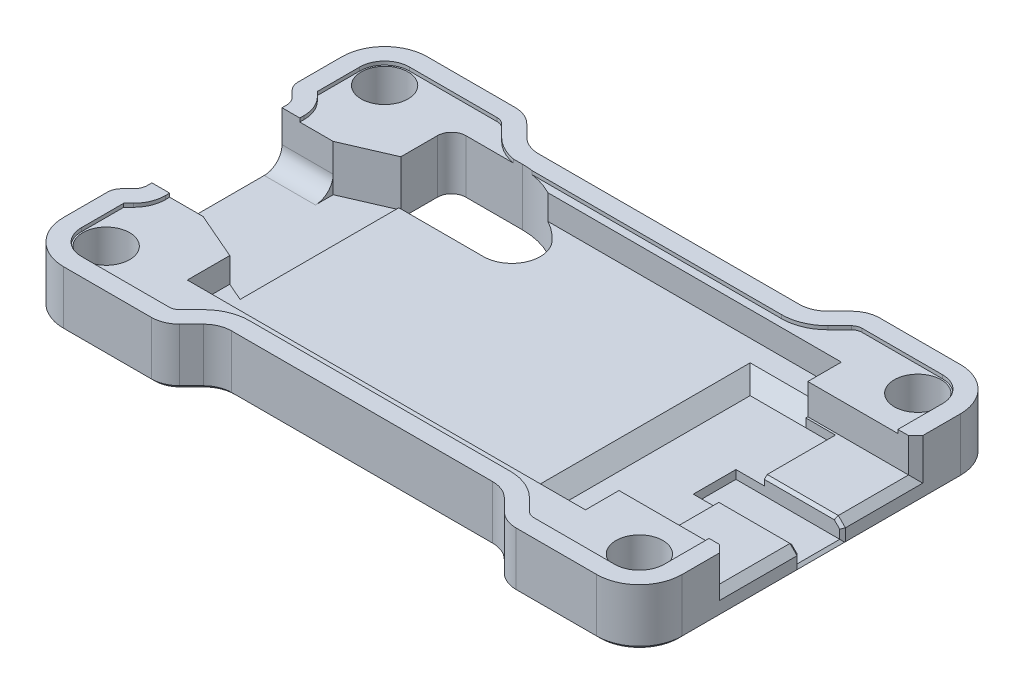
from build123d import *

# Parameters (mm, degrees)
BOSS_EXTRUDE1_DEPTH     = 4
FILLET1_R               = 3
FILLET2_R               = 1
FILLET3_R               = 2
SKETCH2_W               = 8
SKETCH2_H               = 9.15
CUT_EXTRUDE1_DEPTH      = 3.5
FILLET4_R               = 1.25
SKETCH3_W               = 9.941274404
SKETCH3_H               = 15.481085324
BOSS_EXTRUDE2_DEPTH     = 1.6
CHAMFER1_SIZE           = 0.5
SKETCH4_W               = 28
SKETCH4_H               = 18
CUT_EXTRUDE2_DEPTH      = 2
SKETCH5_R               = 1.65
CUT_EXTRUDE3_DEPTH      = 45.562698527
SKETCH6_W               = 3
SKETCH6_H               = 3.2
CUT_EXTRUDE4_DEPTH      = 7.5
CHAMFER2_SIZE           = 0.2
CHAMFER3_SIZE           = 0.25
CUT_EXTRUDE5_DEPTH      = 45.42785275
CUT_EXTRUDE5_DEPTH_BACK = 45.42785275
SKETCH7_W               = 10
SKETCH7_H               = 5
FILLET5_R               = 5
FILLET6_R               = 2
FILLET7_R               = 1
SKETCH9_W               = 4
SKETCH9_H               = 13
CUT_EXTRUDE8_DEPTH      = 1
CHAMFER5_SIZE           = 1
CUT_EXTRUDE9_REACH      = 46.563
CUT_EXTRUDE10_DEPTH     = 0.25


# Some blends are built 0.0001 mm under size
with BuildPart() as part:
    # Sketch1 → Boss-Extrude1 (new body)
    with BuildSketch(Plane(origin=(0, 0, 0), x_dir=(1, 0, 0), z_dir=(0, 1, 0))):
        Polygon((0, -5.29), (0, 5.29), (-1, 6.29), (-1, 12.79), (9, 12.79), (11, 10.79), (31, 10.79), (33, 12.79), (42.5, 12.79), (42.5, 6.64), (33.85, 6.64), (33.85, -6.64), (42.5, -6.64), (42.5, -12.79), (33, -12.79), (31, -10.79), (11, -10.79), (9, -12.79), (-1, -12.79), (-1, -6.29), align=None)
    extrude(amount=BOSS_EXTRUDE1_DEPTH)

    # Fillet1
    fillet1_edges = [part.edges().sort_by_distance(p)[0] for p in [
        (-1, 2, -12.79),
        (42.5, 2, -12.79),
        (42.5, 2, 12.79),
        (-1, 2, 12.79),
    ]]
    fillet(fillet1_edges, radius=FILLET1_R)

    # Fillet2
    fillet2_edges = [part.edges().sort_by_distance(p)[0] for p in [
        (-1, 2, -6.29),
        (33.85, 2, -6.64),
        (33.85, 2, 6.64),
        (-1, 2, 6.29),
        (0, 2, 5.29),
        (0, 2, -5.29),
    ]]
    fillet(fillet2_edges, radius=FILLET2_R)

    # Fillet3
    fillet3_edges = [part.edges().sort_by_distance(p)[0] for p in [
        (9, 2, -12.79),
        (11, 2, -10.79),
        (31, 2, -10.79),
        (33, 2, -12.79),
        (33, 2, 12.79),
        (31, 2, 10.79),
        (11, 2, 10.79),
        (9, 2, 12.79),
    ]]
    fillet(fillet3_edges, radius=FILLET3_R)

    # Sketch2 → Cut-Extrude1 (cut)
    with BuildSketch(Plane(origin=(0, 4, 0), x_dir=(1, 0, 0), z_dir=(0, 1, 0))):
        with Locations((3.75, 0)):
            Rectangle(SKETCH2_W, SKETCH2_H)
    extrude(amount=-CUT_EXTRUDE1_DEPTH, mode=Mode.SUBTRACT)

    # Fillet4
    fillet4_edges = [part.edges().sort_by_distance(p)[0] for p in [
        (3.875, 0.5, 4.575),
        (3.875, 0.5, -4.575),
    ]]
    fillet(fillet4_edges, radius=FILLET4_R)

    # Sketch3 → Boss-Extrude2 (add)
    with BuildSketch(Plane.XZ):
        with Locations((37.529362798, 0.175921424)):
            Rectangle(SKETCH3_W, SKETCH3_H)
    extrude(amount=-BOSS_EXTRUDE2_DEPTH)

    # Chamfer1
    chamfer1_edges = [part.edges().sort_by_distance(p)[0] for p in [
        (42.5, 1.6, 0),
        (42.5, 2.8, -6.64),
        (42.5, 2.8, 6.64),
    ]]
    chamfer(chamfer1_edges, length=CHAMFER1_SIZE)

    # Sketch4 → Cut-Extrude2 (cut)
    with BuildSketch(Plane(origin=(0, 4, 0), x_dir=(1, 0, 0), z_dir=(0, 1, 0))):
        with Locations((20.914926335, 0)):
            Rectangle(SKETCH4_W, SKETCH4_H)
    extrude(amount=-CUT_EXTRUDE2_DEPTH, mode=Mode.SUBTRACT)

    # Sketch5 → Cut-Extrude3 (cut, through all)
    with BuildSketch(Plane(origin=(0, 4, 0), x_dir=(1, 0, 0), z_dir=(0, 1, 0))):
        with Locations(Location((2, 9.79, 0), (0, 0, 270))):
            Circle(SKETCH5_R)
        with Locations(Location((2, -9.79, 0), (0, 0, 270))):
            Circle(SKETCH5_R)
        with Locations(Location((39.5, 9.79, 0), (0, 0, 270))):
            Circle(SKETCH5_R)
        with Locations(Location((39.5, -9.79, 0), (0, 0, 270))):
            Circle(SKETCH5_R)
    extrude(amount=-CUT_EXTRUDE3_DEPTH, mode=Mode.SUBTRACT)

    # Sketch6 → Cut-Extrude4 (cut)
    with BuildSketch(Plane(origin=(42.5, 0, 0), x_dir=(0, 0, -1), z_dir=(1, 0, 0))):
        with Locations((0, 2)):
            Rectangle(SKETCH6_W, SKETCH6_H)
    extrude(amount=-CUT_EXTRUDE4_DEPTH, mode=Mode.SUBTRACT)

    # Chamfer2
    chamfer2_edges = [part.edges().sort_by_distance(p)[0] for p in [
        (42.25, 1.35, 1.5),
        (42.25, 1.35, -1.5),
        (38.5, 1.6, -1.5),
        (38.5, 1.6, 1.5),
        (42.5, 0.75, -1.5),
        (42.5, 0.75, 1.5),
        (42.5, 0.4, 0),
    ]]
    chamfer(chamfer2_edges, length=CHAMFER2_SIZE)

    # Chamfer3
    # the kernel refuses this chamfer: 0.25 mm, written as the material it takes off along each edge
    with BuildSketch(Plane(origin=(-0.292893219, 0, -5.582893219), x_dir=(-0.019442520806013684, 0.9996219169112968, 0.01944252080601369), z_dir=(-0.7071067811865477, 0, -0.7071067811865475)), Plane(origin=(-0.707106781, 0, 5.997106781), x_dir=(-0.019442520806014003, 0.9996219169112968, -0.01944252080601401), z_dir=(0.7071067811865477, 0, -0.7071067811865475))) as chamfer3_piece_1:
        Polygon((CHAMFER3_SIZE * 0.999621916911, CHAMFER3_SIZE * 0.0274958766106), (-CHAMFER3_SIZE * 0.0274958766106, CHAMFER3_SIZE * 0.999621916911), (0, 0), align=None)
    extrude(amount=0.585786438, mode=Mode.SUBTRACT)
    with BuildSketch(Plane(origin=(-1, 0, -4.875786438), x_dir=(0.7071067811865471, 0, -0.7071067811865479), z_dir=(-0.7071067811865479, 0, -0.7071067811865471))) as chamfer3_piece_2:
        Polygon((1, -CHAMFER3_SIZE), (1 + CHAMFER3_SIZE, 0), (1, 0), align=None)
    revolve(axis=Axis((-1, 0, -4.875786438), (0, -1, 0)), revolution_arc=45, mode=Mode.SUBTRACT)
    with BuildSketch(Plane(origin=(0, 0, -6.704213562), x_dir=(-1, 0, 0), z_dir=(0, 0, -1))) as chamfer3_piece_3:
        Polygon((1, CHAMFER3_SIZE), (1 - CHAMFER3_SIZE, 0), (1, 0), align=None)
    revolve(axis=Axis((0, 0, -6.704213562), (0, 1, 0)), revolution_arc=45, mode=Mode.SUBTRACT)
    with BuildSketch(Plane(origin=(0, 0, 4.875786438), x_dir=(-0.027495876610586372, 0.9996219169112968, 0), z_dir=(0, 0, -1))) as chamfer3_piece_4:
        Polygon((CHAMFER3_SIZE * 0.999621916911, CHAMFER3_SIZE * 0.0274958766106), (-CHAMFER3_SIZE * 0.0274958766106, CHAMFER3_SIZE * 0.999621916911), (0, 0), align=None)
    extrude(amount=9.751572875, mode=Mode.SUBTRACT)
    with BuildSketch(Plane(origin=(-1, 0, -6.704213562), x_dir=(-0.027495876610586494, 0.9996219169112968, 0), z_dir=(0, 0, -1)), Plane(origin=(-1, 0, 9.79), x_dir=(-0.027495876610586494, 0.9996219169112968, 0), z_dir=(0, 0, -1))) as chamfer3_piece_5:
        Polygon((CHAMFER3_SIZE * 0.999621916911, CHAMFER3_SIZE * 0.0274958766106), (-CHAMFER3_SIZE * 0.0274958766106, CHAMFER3_SIZE * 0.999621916911), (0, 0), align=None)
    extrude(amount=3.085786438, mode=Mode.SUBTRACT)
    with BuildSketch(Plane(origin=(-1, 0, 4.875786438), x_dir=(1, 0, 0), z_dir=(0, 0, -1))) as chamfer3_piece_6:
        Polygon((1, -CHAMFER3_SIZE), (1 + CHAMFER3_SIZE, 0), (1, 0), align=None)
    revolve(axis=Axis((-1, 0, 4.875786438), (0, -1, 0)), revolution_arc=45, mode=Mode.SUBTRACT)
    with BuildSketch(Plane(origin=(2, 0, -9.79), x_dir=(-1, 0, 0), z_dir=(0, 0, 1))) as chamfer3_piece_7:
        Polygon((3, -CHAMFER3_SIZE), (3 - CHAMFER3_SIZE, 0), (3, 0), align=None)
    revolve(axis=Axis((2, 0, -9.79), (0, -1, 0)), revolution_arc=90, mode=Mode.SUBTRACT)
    with BuildSketch(Plane(origin=(2, 0, -12.79), x_dir=(0, 0.9996219169112968, -0.02749587661058908), z_dir=(1, 0, 0)), Plane(origin=(8.171572875, 0, 12.79), x_dir=(0, 0.9996219169112968, 0.02749587661058908), z_dir=(-1, 0, 0))) as chamfer3_piece_8:
        Polygon((CHAMFER3_SIZE * 0.999621916911, CHAMFER3_SIZE * 0.0274958766106), (-CHAMFER3_SIZE * 0.0274958766106, CHAMFER3_SIZE * 0.999621916911), (0, 0), align=None)
    extrude(amount=6.171572875, mode=Mode.SUBTRACT)
    with BuildSketch(Plane(origin=(0, 0, 6.704213562), x_dir=(-0.7071067811865471, 0, -0.7071067811865479), z_dir=(0.7071067811865479, 0, -0.7071067811865471))) as chamfer3_piece_9:
        Polygon((1, CHAMFER3_SIZE), (1 - CHAMFER3_SIZE, 0), (1, 0), align=None)
    revolve(axis=Axis((0, 0, 6.704213562), (0, 1, 0)), revolution_arc=45, mode=Mode.SUBTRACT)
    with BuildSketch(Plane(origin=(8.171572875, 0, -10.79), x_dir=(0, 0, -1), z_dir=(-1, 0, 0))) as chamfer3_piece_10:
        Polygon((2, -CHAMFER3_SIZE), (2 - CHAMFER3_SIZE, 0), (2, 0), align=None)
    revolve(axis=Axis((8.171572875, 0, -10.79), (0, -1, 0)), revolution_arc=45, mode=Mode.SUBTRACT)
    with BuildSketch(Plane(origin=(9.585786438, 0, -12.204213562), x_dir=(0.01944252080601724, 0.9996219169112965, -0.01944252080601724), z_dir=(0.7071067811865476, 0, 0.7071067811865476)), Plane(origin=(10.414213562, 0, 11.375786438), x_dir=(0.01944252080601724, 0.9996219169112965, 0.01944252080601724), z_dir=(-0.7071067811865476, 0, 0.7071067811865476)), Plane(origin=(31.585786438, 0, -11.375786438), x_dir=(-0.01944252080601034, 0.999621916911297, -0.01944252080601034), z_dir=(0.7071067811865476, 0, -0.7071067811865476)), Plane(origin=(32.414213562, 0, 12.204213562), x_dir=(-0.019442520806020696, 0.9996219169112965, 0.019442520806020696), z_dir=(-0.7071067811865476, 0, -0.7071067811865476))) as chamfer3_piece_11:
        Polygon((CHAMFER3_SIZE * 0.999621916911, CHAMFER3_SIZE * 0.0274958766106), (-CHAMFER3_SIZE * 0.0274958766106, CHAMFER3_SIZE * 0.999621916911), (0, 0), align=None)
    extrude(amount=1.171572875, mode=Mode.SUBTRACT)
    with BuildSketch(Plane(origin=(2, 0, 9.79), x_dir=(0, 0, 1), z_dir=(1, 0, 0))) as chamfer3_piece_12:
        Polygon((3, -CHAMFER3_SIZE), (3 - CHAMFER3_SIZE, 0), (3, 0), align=None)
    revolve(axis=Axis((2, 0, 9.79), (0, -1, 0)), revolution_arc=90, mode=Mode.SUBTRACT)
    with BuildSketch(Plane(origin=(11.828427125, 0, -12.79), x_dir=(-0.707106781186548, 0, 0.7071067811865471), z_dir=(-0.7071067811865471, 0, -0.707106781186548))) as chamfer3_piece_13:
        Polygon((2, CHAMFER3_SIZE), (2 + CHAMFER3_SIZE, 0), (2, 0), align=None)
    revolve(axis=Axis((11.828427125, 0, -12.79), (0, 1, 0)), revolution_arc=45, mode=Mode.SUBTRACT)
    with BuildSketch(Plane(origin=(11.828427125, 0, -10.79), x_dir=(0, 0.9996219169112968, -0.02749587661058908), z_dir=(1, 0, 0)), Plane(origin=(30.171572875, 0, 10.79), x_dir=(0, 0.9996219169112968, 0.02749587661058908), z_dir=(-1, 0, 0))) as chamfer3_piece_14:
        Polygon((CHAMFER3_SIZE * 0.999621916911, CHAMFER3_SIZE * 0.0274958766106), (-CHAMFER3_SIZE * 0.0274958766106, CHAMFER3_SIZE * 0.999621916911), (0, 0), align=None)
    extrude(amount=18.343145751, mode=Mode.SUBTRACT)
    with BuildSketch(Plane(origin=(8.171572875, 0, 10.79), x_dir=(0, 0, 1), z_dir=(-1, 0, 0))) as chamfer3_piece_15:
        Polygon((2, CHAMFER3_SIZE), (2 - CHAMFER3_SIZE, 0), (2, 0), align=None)
    revolve(axis=Axis((8.171572875, 0, 10.79), (0, 1, 0)), revolution_arc=45, mode=Mode.SUBTRACT)
    with BuildSketch(Plane(origin=(30.171572875, 0, -12.79), x_dir=(0, 0, 1), z_dir=(-1, 0, 0))) as chamfer3_piece_16:
        Polygon((2, CHAMFER3_SIZE), (2 + CHAMFER3_SIZE, 0), (2, 0), align=None)
    revolve(axis=Axis((30.171572875, 0, -12.79), (0, 1, 0)), revolution_arc=45, mode=Mode.SUBTRACT)
    with BuildSketch(Plane(origin=(11.828427125, 0, 12.79), x_dir=(-0.7071067811865476, 0, -0.7071067811865476), z_dir=(-0.7071067811865476, 0, 0.7071067811865476))) as chamfer3_piece_17:
        Polygon((2, -CHAMFER3_SIZE), (2 + CHAMFER3_SIZE, 0), (2, 0), align=None)
    revolve(axis=Axis((11.828427125, 0, 12.79), (0, -1, 0)), revolution_arc=45, mode=Mode.SUBTRACT)
    with BuildSketch(Plane(origin=(33.828427125, 0, -10.79), x_dir=(-0.7071067811865462, 0, -0.7071067811865489), z_dir=(-0.7071067811865489, 0, 0.7071067811865462))) as chamfer3_piece_18:
        Polygon((2, -CHAMFER3_SIZE), (2 - CHAMFER3_SIZE, 0), (2, 0), align=None)
    revolve(axis=Axis((33.828427125, 0, -10.79), (0, -1, 0)), revolution_arc=45, mode=Mode.SUBTRACT)
    with BuildSketch(Plane(origin=(33.828427125, 0, -12.79), x_dir=(0, 0.9996219169112968, -0.02749587661058908), z_dir=(1, 0, 0)), Plane(origin=(39.5, 0, 12.79), x_dir=(0, 0.9996219169112968, 0.02749587661058908), z_dir=(-1, 0, 0))) as chamfer3_piece_19:
        Polygon((CHAMFER3_SIZE * 0.999621916911, CHAMFER3_SIZE * 0.0274958766106), (-CHAMFER3_SIZE * 0.0274958766106, CHAMFER3_SIZE * 0.999621916911), (0, 0), align=None)
    extrude(amount=5.671572875, mode=Mode.SUBTRACT)
    with BuildSketch(Plane(origin=(30.171572875, 0, 12.79), x_dir=(0, 0, -1), z_dir=(-1, 0, 0))) as chamfer3_piece_20:
        Polygon((2, -CHAMFER3_SIZE), (2 + CHAMFER3_SIZE, 0), (2, 0), align=None)
    revolve(axis=Axis((30.171572875, 0, 12.79), (0, -1, 0)), revolution_arc=45, mode=Mode.SUBTRACT)
    with BuildSketch(Plane(origin=(39.5, 0, -9.79), x_dir=(0, 0, -1), z_dir=(-1, 0, 0))) as chamfer3_piece_21:
        Polygon((3, -CHAMFER3_SIZE), (3 - CHAMFER3_SIZE, 0), (3, 0), align=None)
    revolve(axis=Axis((39.5, 0, -9.79), (0, -1, 0)), revolution_arc=90, mode=Mode.SUBTRACT)
    with BuildSketch(Plane(origin=(42.5, 0, -9.79), x_dir=(0.027495876610582174, 0.9996219169112968, 0), z_dir=(0, 0, 1))) as chamfer3_piece_22:
        Polygon((CHAMFER3_SIZE * 0.999621916911, CHAMFER3_SIZE * 0.0274958766106), (-CHAMFER3_SIZE * 0.0274958766106, CHAMFER3_SIZE * 0.999621916911), (0, 0), align=None)
    extrude(amount=19.58, mode=Mode.SUBTRACT)
    with BuildSketch(Plane(origin=(33.828427125, 0, 10.79), x_dir=(-0.7071067811865489, 0, 0.7071067811865462), z_dir=(-0.7071067811865462, 0, -0.7071067811865489))) as chamfer3_piece_23:
        Polygon((2, CHAMFER3_SIZE), (2 - CHAMFER3_SIZE, 0), (2, 0), align=None)
    revolve(axis=Axis((33.828427125, 0, 10.79), (0, 1, 0)), revolution_arc=45, mode=Mode.SUBTRACT)
    with BuildSketch(Plane(origin=(39.5, 0, 9.79), x_dir=(1, 0, 0), z_dir=(0, 0, -1))) as chamfer3_piece_24:
        Polygon((3 - CHAMFER3_SIZE, 0), (3, -CHAMFER3_SIZE), (3, 0), align=None)
    revolve(axis=Axis((39.5, 0, 9.79), (0, -1, 0)), revolution_arc=90, mode=Mode.SUBTRACT)

    # Sketch7 → Cut-Extrude5 (cut, two sides: drawn at the far end of the back side and taken through both)
    with BuildSketch(Plane(origin=(0, 2, 0), x_dir=(1, 0, 0), z_dir=(0, 1, 0)).offset(-CUT_EXTRUDE5_DEPTH_BACK)):
        with Locations((11.914926335, 7.09)):
            Rectangle(SKETCH7_W, SKETCH7_H)
    extrude(amount=CUT_EXTRUDE5_DEPTH + CUT_EXTRUDE5_DEPTH_BACK, mode=Mode.SUBTRACT)

    # Fillet5
    fillet5_edges = [part.edges().sort_by_distance(p)[0] for p in [
        (16.914926335, 2, -9.59),
    ]]
    fillet(fillet5_edges, radius=FILLET5_R - 0.0001)  # a hair under: the kernel refuses the full size

    # Fillet6
    fillet6_edges = [part.edges().sort_by_distance(p)[0] for p in [
        (16.914926335, 1, -4.59),
    ]]
    fillet(fillet6_edges, radius=FILLET6_R)

    # Fillet7
    fillet7_edges = [part.edges().sort_by_distance(p)[0] for p in [
        (6.914926335, 1, -4.59),
        (6.914926335, 2, -9.59),
    ]]
    fillet(fillet7_edges, radius=FILLET7_R)

    # Sketch9 → Cut-Extrude8 (cut)
    with BuildSketch(Plane(origin=(0, 2, 0), x_dir=(1, 0, 0), z_dir=(0, 1, 0))):
        with Locations((35, 0)):
            Rectangle(SKETCH9_W, SKETCH9_H)
    extrude(amount=-CUT_EXTRUDE8_DEPTH, mode=Mode.SUBTRACT)

    # Chamfer4
    # the kernel refuses this chamfer: 3 mm, written as the material it takes off along each edge
    with BuildSketch(Plane(origin=(33, 2, -6.5), x_dir=(-0.9996219169112968, 0.027495876610586334, 0), z_dir=(0, 0, 1))) as chamfer4_piece_1_section:
        with BuildLine():
            Line((3.086019586, 0), (-0.169641465, 3.081353381))
            Line((-0.169641465, 3.081353381), (-0.22961878, 3.079703628))
            ThreePointArc((-0.22961878, 3.079703628), (-0.102387681, 1.540193489), (-0.059977315, -0.001649753))
            Line((-0.059977315, -0.001649753), (0.001649753, -0.059977315))
            ThreePointArc((0.001649753, -0.059977315), (1.543492994, -0.017566949), (3.087669338, -0.059977315))
            Line((3.087669338, -0.059977315), (3.086019586, 0))
        make_face()
    chamfer4_piece_1 = extrude(amount=13, mode=Mode.PRIVATE)
    chamfer4_piece_1 = split(chamfer4_piece_1, bisect_by=Plane(origin=(31.713879333, 1, 0), z_dir=(0, 1, 0)), keep=Keep.TOP, mode=Mode.PRIVATE)
    add(chamfer4_piece_1, mode=Mode.SUBTRACT)

    # Chamfer5
    # the kernel refuses this chamfer: 1 mm, written as the material it takes off along each edge
    with BuildSketch(Plane(origin=(36.911388955, 2, 6.5), x_dir=(-1.0024708687230913e-14, 0.027495876610586487, 0.9996219169112968), z_dir=(-1, 0, 0))) as chamfer5_piece_1_section:
        Polygon((CHAMFER5_SIZE * 0.999621916911, -CHAMFER5_SIZE * 0.0274958766106), (-CHAMFER5_SIZE * 0.0274958766106, -CHAMFER5_SIZE * 0.999621916911), (0, 0), align=None)
    chamfer5_piece_1 = extrude(amount=9.483071943, mode=Mode.PRIVATE)
    chamfer5_piece_1 = split(chamfer5_piece_1, bisect_by=Plane(origin=(34.914926335, 1.685062516, 6.837727925), z_dir=(-1, 0, 0)), keep=Keep.TOP, mode=Mode.PRIVATE)
    chamfer5_piece_1 = split(chamfer5_piece_1, bisect_by=Plane(origin=(31.464934697, 0.535065303, 6.837727925), z_dir=(0.7071067811868917, 0.7071067811862034, 0)), keep=Keep.TOP, mode=Mode.PRIVATE)
    chamfer5_piece_1 = split(chamfer5_piece_1, bisect_by=Plane(origin=(32.61493191, 1, 6.837727925), z_dir=(0, 1, 0)), keep=Keep.TOP, mode=Mode.PRIVATE)
    add(chamfer5_piece_1, mode=Mode.SUBTRACT)
    with BuildSketch(Plane(origin=(27.428317012, 2, -6.5), x_dir=(-9.615536904078628e-15, 0.027495876610586487, -0.9996219169112968), z_dir=(1, 0, 0))) as chamfer5_piece_2_section:
        Polygon((CHAMFER5_SIZE * 0.999621916911, -CHAMFER5_SIZE * 0.0274958766106), (-CHAMFER5_SIZE * 0.0274958766106, -CHAMFER5_SIZE * 0.999621916911), (0, 0), align=None)
    chamfer5_piece_2 = extrude(amount=9.483071943, mode=Mode.PRIVATE)
    chamfer5_piece_2 = split(chamfer5_piece_2, bisect_by=Plane(origin=(34.914926335, 1.685062516, -6.837727925), z_dir=(-1, 0, 0)), keep=Keep.TOP, mode=Mode.PRIVATE)
    chamfer5_piece_2 = split(chamfer5_piece_2, bisect_by=Plane(origin=(32.61493191, 1, -6.837727925), z_dir=(0, 1, 0)), keep=Keep.TOP, mode=Mode.PRIVATE)
    chamfer5_piece_2 = split(chamfer5_piece_2, bisect_by=Plane(origin=(31.464934697, 0.535065303, -6.837727925), z_dir=(0.7071067811868917, 0.7071067811862034, 0)), keep=Keep.TOP, mode=Mode.PRIVATE)
    add(chamfer5_piece_2, mode=Mode.SUBTRACT)

    # Cut-Extrude9: up to this face of the body (flat: up to its plane)
    cut_extrude9_end = Plane(part.part.faces().sort_by_distance((3.875, 0.5, 0))[0])
    # Sketch8 → Cut-Extrude9 (cut, up to the picked face)
    with BuildSketch(Plane(origin=(0, 4, 0), x_dir=(1, 0, 0), z_dir=(0, 1, 0)), mode=Mode.PRIVATE) as cut_extrude9_sk1:
        Polygon((3.597661146, 4.575), (8.202098445, 6.575), (8.202098445, -6.575), (3.597661146, -4.575), align=None)
    cut_extrude9_tool1 = split(extrude(cut_extrude9_sk1.sketch, amount=-CUT_EXTRUDE9_REACH, mode=Mode.PRIVATE), bisect_by=cut_extrude9_end, keep=Keep.BOTH, mode=Mode.PRIVATE)
    add(cut_extrude9_tool1.solids().sort_by(Axis((6.037531, 4, 0), (0, -1, 0)))[0], mode=Mode.SUBTRACT)

    # Sketch11 → Cut-Extrude10 (cut)
    with BuildSketch(Plane(origin=(0, 4, 0), x_dir=(1, 0, 0), z_dir=(0, 1, 0))):
        with BuildLine():
            Line((0.25, 6.807766953), (0.590990258, 6.466776695))
            ThreePointArc((0.590990258, 6.466776695), (1.078728948, 5.73682416), (1.25, 4.875786438))
            Line((1.25, 4.875786438), (1.25, -4.875786438))
            ThreePointArc((1.25, -4.875786438), (1.078728948, -5.73682416), (0.590990258, -6.466776695))
            Line((0.590990258, -6.466776695), (0.25, -6.807766953))
            Line((0.25, -6.807766953), (0.25, -9.79))
            ThreePointArc((0.25, -9.79), (0.762563133, -11.027436867), (2, -11.54))
            Line((2, -11.54), (8.171572875, -11.54))
            ThreePointArc((8.171572875, -11.54), (8.45858545, -11.482909649), (8.701902961, -11.320330086))
            Line((8.701902961, -11.320330086), (9.530330086, -10.491902961))
            ThreePointArc((9.530330086, -10.491902961), (10.58470597, -9.787391519), (11.828427125, -9.54))
            Line((11.828427125, -9.54), (30.171572875, -9.54))
            ThreePointArc((30.171572875, -9.54), (31.41529403, -9.787391519), (32.469669914, -10.491902961))
            Line((32.469669914, -10.491902961), (33.298097039, -11.320330086))
            ThreePointArc((33.298097039, -11.320330086), (33.54141455, -11.482909649), (33.828427125, -11.54))
            Line((33.828427125, -11.54), (39.5, -11.54))
            ThreePointArc((39.5, -11.54), (40.737436867, -11.027436867), (41.25, -9.79))
            Line((41.25, -9.79), (41.25, 9.79))
            ThreePointArc((41.25, 9.79), (40.737436867, 11.027436867), (39.5, 11.54))
            Line((39.5, 11.54), (33.828427125, 11.54))
            ThreePointArc((33.828427125, 11.54), (33.54141455, 11.482909649), (33.298097039, 11.320330086))
            Line((33.298097039, 11.320330086), (32.469669914, 10.491902961))
            ThreePointArc((32.469669914, 10.491902961), (31.41529403, 9.787391519), (30.171572875, 9.54))
            Line((30.171572875, 9.54), (11.828427125, 9.54))
            ThreePointArc((11.828427125, 9.54), (10.58470597, 9.787391519), (9.530330086, 10.491902961))
            Line((9.530330086, 10.491902961), (8.701902961, 11.320330086))
            ThreePointArc((8.701902961, 11.320330086), (8.45858545, 11.482909649), (8.171572875, 11.54))
            Line((8.171572875, 11.54), (2, 11.54))
            ThreePointArc((2, 11.54), (0.762563133, 11.027436867), (0.25, 9.79))
            Line((0.25, 9.79), (0.25, 6.807766953))
        make_face()
    extrude(amount=-CUT_EXTRUDE10_DEPTH, mode=Mode.SUBTRACT)


solid = part.part
